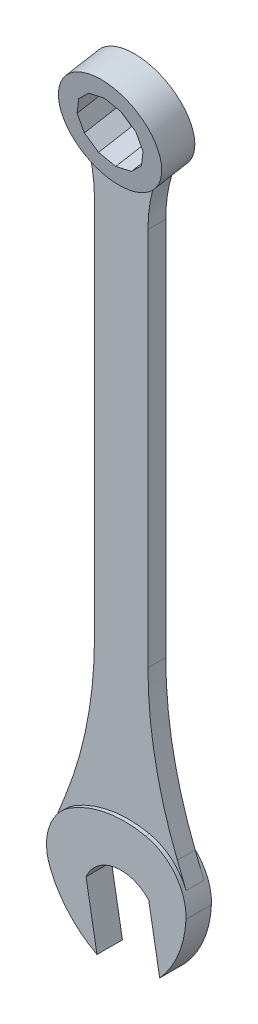
from build123d import *

# Parameters (mm, degrees)
HEAD_EXTRUDE_DEPTH        = 3.175
HEAD_EXTRUDE_DEPTH_BACK   = 3.175
HANDLE_EXTRUDE_DEPTH      = 2.2225
HANDLE_EXTRUDE_DEPTH_BACK = 2.2225
REAR_CIRCLE_DEPTH         = 3.302
REAR_CIRCLE_DEPTH_BACK    = 5.08
REAR_CIRCLE_SKETCH_R      = 12.7
CUT_REAR_HOLE_DEPTH       = 178.671960669
CUT_REAR_HOLE_DEPTH_BACK  = 178.671960669


with BuildPart() as part:
    # head + handle sketch → head extrude (new, two sides: drawn at the far end of the back side and taken through both)
    with BuildSketch(Plane(origin=(0, 0, 0), x_dir=(0, 1, 0), z_dir=(0, 0, 1)).offset(-HEAD_EXTRUDE_DEPTH_BACK)):
        with BuildLine():
            Line((-16.837056671, 5.091121365), (-1.37833241, 7.81691154))
            ThreePointArc((-1.37833241, 7.81691154), (4.236175861, 0.746952099), (1.37833241, -7.81691154))
            Line((1.37833241, -7.81691154), (-14.08039185, -10.542701714))
            ThreePointArc((-14.08039185, -10.542701714), (-6.685826637, -15.212601851), (1.854333587, -17.097601941))
            ThreePointArc((1.854333587, -17.097601941), (4.551290783, -16.929171519), (7.151565448, -16.193971826))
            ThreePointArc((7.151565448, -16.193971826), (12.135232427, -12.584414708), (14.837059135, -7.055764638))
            ThreePointArc((14.837059135, -7.055764638), (15.008470156, 2.646398228), (11.52906135, 11.704823057))
            ThreePointArc((11.52906135, 11.704823057), (8.896810749, 14.722719081), (5.455718338, 16.770967761))
            ThreePointArc((5.455718338, 16.770967761), (0.668384677, 17.669935903), (-4.105220678, 16.700709816))
            ThreePointArc((-4.105220678, 16.700709816), (-11.48563822, 12.008482318), (-16.837056671, 5.091121365))
        make_face()
    extrude(amount=HEAD_EXTRUDE_DEPTH + HEAD_EXTRUDE_DEPTH_BACK)

    # Sketch2<3> → handle extrude (add, two sides: drawn at the far end of the back side and taken through both)
    with BuildSketch(Plane(origin=(0, 0, 0), x_dir=(0, 1, 0), z_dir=(0, 0, 1)).offset(-HANDLE_EXTRUDE_DEPTH_BACK)):
        with BuildLine():
            Line((12.768858992, 13.8619882), (5.455718338, 16.770967761))
            ThreePointArc((5.455718338, 16.770967761), (8.896810749, 14.722719081), (11.52906135, 11.704823057))
            ThreePointArc((11.52906135, 11.704823057), (15.008470156, 2.646398228), (14.837059135, -7.055764638))
            ThreePointArc((14.837059135, -7.055764638), (12.135232427, -12.584414708), (7.151565448, -16.193971826))
            Line((7.151565448, -16.193971826), (12.621031398, -13.995845889))
            ThreePointArc((12.621031398, -13.995845889), (31.213347454, -8.516409636), (50.507905526, -6.6675))
            Line((50.507905526, -6.6675), (145.155718338, -6.6675))
            ThreePointArc((145.155718338, -6.6675), (155.055661598, -8.042920845), (164.205718338, -12.065))
            Line((164.205718338, -12.065), (164.205718338, 12.065))
            ThreePointArc((164.205718338, 12.065), (155.055661598, 8.042920845), (145.155718338, 6.6675))
            Line((145.155718338, 6.6675), (50.320947374, 6.6675))
            ThreePointArc((50.320947374, 6.6675), (31.203416138, 8.482330764), (12.768858992, 13.8619882))
        make_face()
    extrude(amount=HANDLE_EXTRUDE_DEPTH + HANDLE_EXTRUDE_DEPTH_BACK)

    # rear circle sketch → rear circle (add, two sides: drawn at the far end of the back side and taken through both)
    with BuildSketch(Plane(origin=(0, 4.978374154, -28.233762832), x_dir=(-1, 0, 0), z_dir=(0, 0.17364817766692414, -0.9848077530122091)).offset(-REAR_CIRCLE_DEPTH_BACK)):
        with Locations((0, 162.591760022)):
            Circle(REAR_CIRCLE_SKETCH_R)
    extrude(amount=REAR_CIRCLE_DEPTH + REAR_CIRCLE_DEPTH_BACK)

    # rear circle sketch<3> → cut rear hole (cut, two sides: drawn at the far end of the back side and taken through both)
    with BuildSketch(Plane(origin=(0, 4.978374154, -28.233762832), x_dir=(-1, 0, 0), z_dir=(0, 0.17364817766692414, -0.9848077530122091)).offset(-CUT_REAR_HOLE_DEPTH_BACK)):
        Polygon((-8.217504682, 162.591760022), (-7.11656781, 158.483007681), (-4.108752341, 155.475192212), (0, 154.37425534), (4.108752341, 155.475192212), (7.11656781, 158.483007681), (8.217504682, 162.591760022), (7.11656781, 166.700512363), (4.108752341, 169.708327833), (0, 170.809264704), (-4.108752341, 169.708327833), (-7.11656781, 166.700512363), align=None)
    extrude(amount=CUT_REAR_HOLE_DEPTH + CUT_REAR_HOLE_DEPTH_BACK, mode=Mode.SUBTRACT)


solid = part.part
